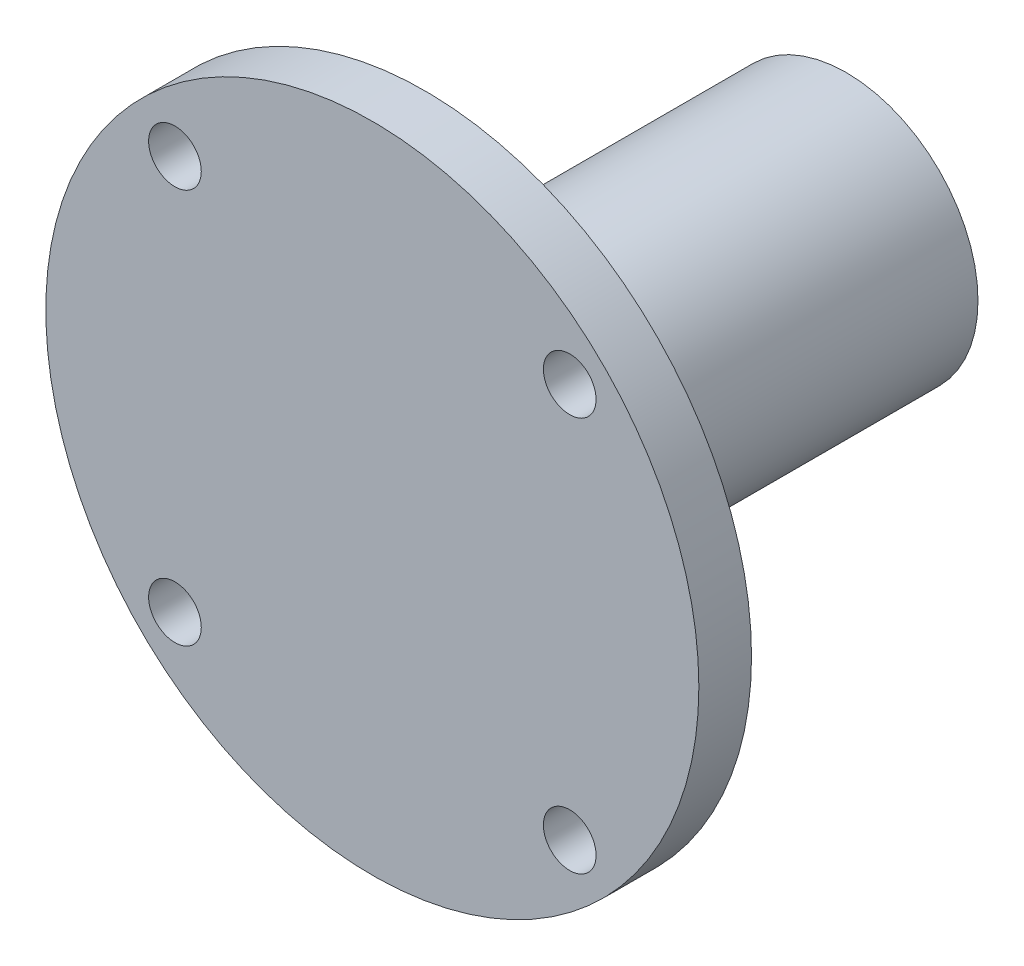
from build123d import *

# Parameters (mm, degrees)
SZKIC1_R                    = 12.5
SZKIC1_R_2                  = 8
DODANIE_WYCI_GNI_CIE1_DEPTH = 30
SZKIC2_R                    = 20
DODANIE_WYCI_GNI_CIE3_DEPTH = 10
SZKIC3_R                    = 31
DODANIE_WYCI_GNI_CIE4_DEPTH = 5
SFAZOWANIE1_SIZE            = 10
OTWORY_USTALAJ_CE_5_0MM1_D  = 5


with BuildPart() as part:
    # Szkic1 → Dodanie-wyciągnięcie1 (new body)
    with BuildSketch(Plane.XY):
        Circle(SZKIC1_R)
        Circle(SZKIC1_R_2, mode=Mode.SUBTRACT)
    extrude(amount=DODANIE_WYCI_GNI_CIE1_DEPTH)

    # Szkic2 → Dodanie-wyciągnięcie3 (add)
    with BuildSketch(Plane.XY.offset(30)):
        Circle(SZKIC2_R)
    extrude(amount=DODANIE_WYCI_GNI_CIE3_DEPTH)

    # Szkic3 → Dodanie-wyciągnięcie4 (add)
    with BuildSketch(Plane.XY.offset(40)):
        Circle(SZKIC3_R)
    extrude(amount=DODANIE_WYCI_GNI_CIE4_DEPTH)

    # Sfazowanie1
    # the kernel refuses this chamfer: 10 mm, written as the material it takes off along each edge
    with BuildSketch(Plane(origin=(0, 0, 30), x_dir=(1, 0, 0), z_dir=(0, -1, 0))) as sfazowanie1_piece_1_section:
        Polygon((20, SFAZOWANIE1_SIZE), (20 - SFAZOWANIE1_SIZE, 0), (20, 0), align=None)
    sfazowanie1_piece_1 = revolve(axis=Axis((0, 0, 30), (0, 0, 1)), mode=Mode.PRIVATE)
    sfazowanie1_piece_1 = split(sfazowanie1_piece_1, bisect_by=Plane(origin=(-16.374530577, 0, 40), z_dir=(0, 0, -1)), keep=Keep.TOP, mode=Mode.PRIVATE)
    sfazowanie1_piece_1 = sfazowanie1_piece_1 - Plane(origin=(0, 0, 36.125469423), x_dir=(1, 0, 0), z_dir=(0, 0, -1)) * Cylinder(12.5, 80, mode=Mode.PRIVATE)
    add(sfazowanie1_piece_1, mode=Mode.SUBTRACT)

    # Otwory ustalające Ø5.0mm1 (through all)
    with Locations(Plane(origin=(-18.74, 18.74, 45), x_dir=(1, 0, 0), z_dir=(0, 0, 1))):
        with Locations((0, 0), (37.48, 0), (37.48, -37.48), (0, -37.48)):
            Hole(OTWORY_USTALAJ_CE_5_0MM1_D / 2)


solid = part.part
